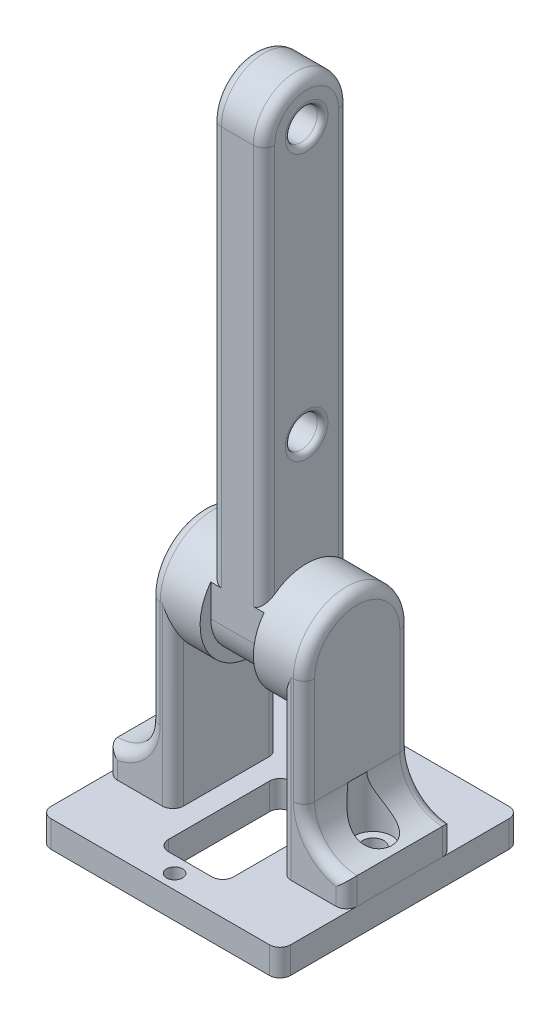
from build123d import *

# Parameters (mm, degrees)
CROQUIS1_W              = 45
CROQUIS1_H              = 45
CROQUIS1_R              = 2
CROQUIS1_R_2            = 1.5
CROQUIS1_W_2            = 12.2
CROQUIS1_H_2            = 23
SALIENTE_EXTRUIR1_DEPTH = 5
CORTAR_EXTRUIR1_START   = -2
CROQUIS2_R              = 2
CROQUIS2_R_2            = 1.5
CORTAR_EXTRUIR1_DEPTH   = 2
CROQUIS3_R              = 3
SALIENTE_EXTRUIR2_DEPTH = 5
SALIENTE_EXTRUIR4_DEPTH = 20
CORTAR_EXTRUIR2_START   = 10
CROQUIS4_R              = 2
CORTAR_EXTRUIR2_DEPTH   = 10
CROQUIS6_R              = 10
SALIENTE_EXTRUIR5_DEPTH = 9.5
REDONDEO3_R             = 2
REDONDEO4_R             = 1
REDONDEO5_R             = 2
CORTAR_EXTRUIR3_START   = 13
CROQUIS4_3_R            = 3.5
CROQUIS4_3_R_2          = 2
CORTAR_EXTRUIR3_DEPTH   = 9.79796
CORTAR_EXTRUIR4_START   = 3.202041
CROQUIS7_R              = 3.5
CROQUIS7_R_2            = 2
CORTAR_EXTRUIR4_DEPTH   = 9.797959


with BuildPart() as part:
    # Croquis1 → Saliente-Extruir1 (new body)
    with BuildSketch(Plane(origin=(0, 0, 0), x_dir=(1, 0, 0), z_dir=(0, 1, 0))):
        with Locations((0, 5.35)):
            Rectangle(CROQUIS1_W, CROQUIS1_H)
        with Locations(Location((-17.5, 5.35, 0), (0, 0, 270))):
            Circle(CROQUIS1_R, mode=Mode.SUBTRACT)
        with Locations(Location((17.5, 5.35, 0), (0, 0, 270))):
            Circle(CROQUIS1_R, mode=Mode.SUBTRACT)
        with Locations(Location((0, 14.45, 0), (0, 0, 270))):
            Circle(CROQUIS1_R_2, mode=Mode.SUBTRACT)
        with Locations(Location((0, -14.45, 0), (0, 0, 270))):
            Circle(CROQUIS1_R_2, mode=Mode.SUBTRACT)
        Rectangle(CROQUIS1_W_2, CROQUIS1_H_2, mode=Mode.SUBTRACT)
    extrude(amount=-SALIENTE_EXTRUIR1_DEPTH)

    # Croquis2 → Cortar-Extruir1 (cut)
    # profile 1 of 2: a face of its own
    with BuildSketch(Plane.XZ.offset(5).offset(CORTAR_EXTRUIR1_START)):
        with Locations(Location((0, -14.45, 0), (0, 0, 270))):
            Circle(CROQUIS2_R)
        with Locations(Location((0, -14.45, 0), (0, 0, 90))):
            Circle(CROQUIS2_R_2, mode=Mode.SUBTRACT)
    # profile 2 of 2: a face of its own
    with BuildSketch(Plane.XZ.offset(5).offset(CORTAR_EXTRUIR1_START)):
        with Locations(Location((0, 14.45, 0), (0, 0, 270))):
            Circle(CROQUIS2_R)
        with Locations(Location((0, 14.45, 0), (0, 0, 90))):
            Circle(CROQUIS2_R_2, mode=Mode.SUBTRACT)
    extrude(amount=CORTAR_EXTRUIR1_DEPTH, mode=Mode.SUBTRACT)

    # Redondeo3
    redondeo3_edges = [part.edges().sort_by_distance(p)[0] for p in [
        (-22.5, -2.5, 17.15),
        (-22.5, -2.5, -27.85),
        (22.5, -2.5, -27.85),
        (22.5, -2.5, 17.15),
        (6.1, -2.5, -11.5),
        (-6.1, -2.5, -11.5),
        (-6.1, -2.5, 11.5),
        (6.1, -2.5, 11.5),
    ]]
    fillet(redondeo3_edges, radius=REDONDEO3_R)


with BuildPart() as body_2:
    # Croquis3 → Saliente-Extruir2 (new, symmetric)
    with BuildSketch(Plane(origin=(0, 0, 0), x_dir=(0, 0, -1), z_dir=(1, 0, 0))):
        with BuildLine():
            Line((-2.65, 114), (-2.65, 33))
            ThreePointArc((-2.65, 33), (5.35, 25), (13.35, 33))
            Line((13.35, 33), (13.35, 114))
            ThreePointArc((13.35, 114), (5.35, 122), (-2.65, 114))
        make_face()
        with Locations((5.35, 64)):
            Circle(CROQUIS3_R, mode=Mode.SUBTRACT)
        with Locations((5.35, 114)):
            Circle(CROQUIS3_R, mode=Mode.SUBTRACT)
    extrude(amount=SALIENTE_EXTRUIR2_DEPTH, both=True)

    # Redondeo4
    redondeo4_edges = [body_2.edges().sort_by_distance(p)[0] for p in [
        (5, 114, -2.35),
        (5, 64, -2.35),
        (-5, 64, -2.35),
        (-5, 114, -2.35),
    ]]
    fillet(redondeo4_edges, radius=REDONDEO4_R)


with BuildPart() as body_3:
    # Croquis5 → Saliente-Extruir4 (new body)
    with BuildSketch(Plane.XY.offset(4.65)):
        with BuildLine():
            Line((10.1, 33), (10.1, 0))
            Line((10.1, 0), (22.5, 0))
            Line((22.5, 0), (22.5, 5))
            ThreePointArc((22.5, 5), (16.843145751, 7.343145751), (14.5, 13))
            Line((14.5, 13), (14.5, 33))
            Line((14.5, 33), (10.1, 33))
        make_face()
    extrude(amount=-SALIENTE_EXTRUIR4_DEPTH)

    # Croquis4 → Cortar-Extruir2 (cut)
    with BuildSketch(Plane(origin=(0, 0, 0), x_dir=(1, 0, 0), z_dir=(0, 1, 0)).offset(CORTAR_EXTRUIR2_START)):
        with Locations(Location((17.5, 5.35, 0), (0, 0, 270))):
            Circle(CROQUIS4_R)
    extrude(amount=-CORTAR_EXTRUIR2_DEPTH, mode=Mode.SUBTRACT)

    # Croquis6 → Saliente-Extruir5 (add)
    with BuildSketch(Plane(origin=(14.5, 0, 0), x_dir=(0, 0, -1), z_dir=(1, 0, 0))):
        with Locations((5.35, 33)):
            Circle(CROQUIS6_R)
    extrude(amount=-SALIENTE_EXTRUIR5_DEPTH)


with BuildPart() as body_4:
    # Simetría3: mirrored copy
    add(body_3.part.mirror(Plane(origin=(0, 0, 0), x_dir=(0, 0, 1), z_dir=(1, 0, 0))))


with BuildPart() as body_2_1:
    add(body_2.part)

    # Combinar2: union body 4, body 3
    add(body_4.part)
    add(body_3.part)

    # Redondeo5
    # the kernel refuses this fillet: 2 mm, written as the material it takes off along each edge
    with BuildSketch(Plane(origin=(-5, 114, 2.65), x_dir=(1, 0, 0), z_dir=(0, -1, 0))) as redondeo5_piece_1_section:
        with BuildLine():
            CenterArc((REDONDEO5_R, -REDONDEO5_R), REDONDEO5_R, 90, 90)
            Line((0, -REDONDEO5_R), (0, 0))
            Line((0, 0), (REDONDEO5_R, 0))
        make_face()
    redondeo5_piece_1 = extrude(amount=80, mode=Mode.PRIVATE)
    redondeo5_piece_1 = redondeo5_piece_1 - Plane(origin=(-4.548383498, 33, -5.35), x_dir=(0, 0, -1), z_dir=(-1, 0, 0)) * Cylinder(10, 168, mode=Mode.PRIVATE)
    add(redondeo5_piece_1, mode=Mode.SUBTRACT)
    with BuildSketch(Plane(origin=(-5, 114, -5.35), x_dir=(0, 0, -1), z_dir=(0, -1, 0))) as redondeo5_piece_2:
        with BuildLine():
            CenterArc((8 - REDONDEO5_R, REDONDEO5_R), REDONDEO5_R, 270, 90)
            Line((8 - REDONDEO5_R, 0), (8, 0))
            Line((8, 0), (8, REDONDEO5_R))
        make_face()
    revolve(axis=Axis((-5, 114, -5.35), (1, 0, 0)), revolution_arc=180, mode=Mode.SUBTRACT)
    with BuildSketch(Plane(origin=(-5, 34, -13.35), x_dir=(1, 0, 0), z_dir=(0, 1, 0))) as redondeo5_piece_3_section:
        with BuildLine():
            CenterArc((REDONDEO5_R, -REDONDEO5_R), REDONDEO5_R, 90, 90)
            Line((0, -REDONDEO5_R), (0, 0))
            Line((0, 0), (REDONDEO5_R, 0))
        make_face()
    redondeo5_piece_3 = extrude(amount=80, mode=Mode.PRIVATE)
    redondeo5_piece_3 = redondeo5_piece_3 - Plane(origin=(-4.548386162, 33, -5.35), x_dir=(0, 0, -1), z_dir=(-1, 0, 0)) * Cylinder(10, 169, mode=Mode.PRIVATE)
    add(redondeo5_piece_3, mode=Mode.SUBTRACT)
    with BuildSketch(Plane(origin=(5, 114, -5.35), x_dir=(0, 0, -1), z_dir=(0, -1, 0))) as redondeo5_piece_4:
        with BuildLine():
            CenterArc((8 - REDONDEO5_R, -REDONDEO5_R), REDONDEO5_R, 0, 90)
            Line((8, -REDONDEO5_R), (8, 0))
            Line((8, 0), (8 - REDONDEO5_R, 0))
        make_face()
    revolve(axis=Axis((5, 114, -5.35), (1, 0, 0)), revolution_arc=180, mode=Mode.SUBTRACT)
    with BuildSketch(Plane(origin=(5, 114, 2.65), x_dir=(0, 0, -1), z_dir=(0, -1, 0))) as redondeo5_piece_5_section:
        with BuildLine():
            CenterArc((REDONDEO5_R, -REDONDEO5_R), REDONDEO5_R, 90, 90)
            Line((0, -REDONDEO5_R), (0, 0))
            Line((0, 0), (REDONDEO5_R, 0))
        make_face()
    redondeo5_piece_5 = extrude(amount=80, mode=Mode.PRIVATE)
    redondeo5_piece_5 = redondeo5_piece_5 - Plane(origin=(4.662757954, 33, -5.35), x_dir=(0, 0, -1), z_dir=(1, 0, 0)) * Cylinder(10, 168, mode=Mode.PRIVATE)
    add(redondeo5_piece_5, mode=Mode.SUBTRACT)
    with BuildSketch(Plane(origin=(-22.5, 13, 4.65), x_dir=(-0.5853008610590881, -0.8108161949810142, 0), z_dir=(-0.8108161949810142, 0.5853008610590881, 0))) as redondeo5_piece_6:
        with BuildLine():
            CenterArc((8 + REDONDEO5_R, -REDONDEO5_R), REDONDEO5_R, 90, 90)
            Line((8, -REDONDEO5_R), (8, 0))
            Line((8, 0), (8 + REDONDEO5_R, 0))
        make_face()
    revolve(axis=Axis((-22.5, 13, 4.65), (0, 0, 1)), revolution_arc=125.824247309, mode=Mode.SUBTRACT)
    with BuildSketch(Plane(origin=(-10.1, 38, -15.35), x_dir=(0, 0, 1), z_dir=(0, -1, 0))) as redondeo5_piece_7_section:
        with BuildLine():
            CenterArc((REDONDEO5_R, REDONDEO5_R), REDONDEO5_R, 180, 90)
            Line((0, REDONDEO5_R), (0, 0))
            Line((0, 0), (REDONDEO5_R, 0))
        make_face()
    redondeo5_piece_7 = extrude(amount=43, mode=Mode.PRIVATE)
    redondeo5_piece_7 = redondeo5_piece_7 - Plane(origin=(-10.55636002, 33, -5.35), x_dir=(0, 0, -1), z_dir=(-1, 0, 0)) * Cylinder(10, 94, mode=Mode.PRIVATE)
    add(redondeo5_piece_7, mode=Mode.SUBTRACT)
    with BuildSketch(Plane(origin=(-14.5, 13, 4.65), x_dir=(0, 0, -1), z_dir=(0, 1, 0)), Plane(origin=(14.5, 13, -15.35), x_dir=(0, 0, 1), z_dir=(0, 1, 0))) as redondeo5_piece_8:
        with BuildLine():
            CenterArc((REDONDEO5_R, -REDONDEO5_R), REDONDEO5_R, 90, 90)
            Line((0, -REDONDEO5_R), (0, 0))
            Line((0, 0), (REDONDEO5_R, 0))
        make_face()
    extrude(amount=20, mode=Mode.SUBTRACT)
    with BuildSketch(Plane(origin=(-22.5, -5, 4.65), x_dir=(1, 0, 0), z_dir=(0, 1, 0)), Plane(origin=(22.5, -5, -15.35), x_dir=(-1, 0, 0), z_dir=(0, 1, 0))) as redondeo5_piece_9:
        with BuildLine():
            CenterArc((REDONDEO5_R, REDONDEO5_R), REDONDEO5_R, 180, 90)
            Line((0, REDONDEO5_R), (0, 0))
            Line((0, 0), (REDONDEO5_R, 0))
        make_face()
    extrude(amount=15, mode=Mode.SUBTRACT)
    with BuildSketch(Plane(origin=(-22.5, -5, -15.35), x_dir=(1, 0, 0), z_dir=(0, 1, 0)), Plane(origin=(22.5, -5, 4.65), x_dir=(-1, 0, 0), z_dir=(0, 1, 0))) as redondeo5_piece_10:
        with BuildLine():
            CenterArc((REDONDEO5_R, -REDONDEO5_R), REDONDEO5_R, 90, 90)
            Line((0, -REDONDEO5_R), (0, 0))
            Line((0, 0), (REDONDEO5_R, 0))
        make_face()
    extrude(amount=15, mode=Mode.SUBTRACT)
    with BuildSketch(Plane(origin=(-22.5, 13, -15.35), x_dir=(-0.5853008610590881, -0.8108161949810142, 0), z_dir=(-0.8108161949810142, 0.5853008610590881, 0))) as redondeo5_piece_11:
        with BuildLine():
            CenterArc((8 + REDONDEO5_R, REDONDEO5_R), REDONDEO5_R, 180, 90)
            Line((8, REDONDEO5_R), (8, 0))
            Line((8, 0), (8 + REDONDEO5_R, 0))
        make_face()
    revolve(axis=Axis((-22.5, 13, -15.35), (0, 0, 1)), revolution_arc=125.824247309, mode=Mode.SUBTRACT)
    with BuildSketch(Plane(origin=(-14.5, 13, -15.35), x_dir=(0, 0, 1), z_dir=(0, 1, 0)), Plane(origin=(14.5, 13, 4.65), x_dir=(0, 0, -1), z_dir=(0, 1, 0))) as redondeo5_piece_12:
        with BuildLine():
            CenterArc((REDONDEO5_R, REDONDEO5_R), REDONDEO5_R, 180, 90)
            Line((0, REDONDEO5_R), (0, 0))
            Line((0, 0), (REDONDEO5_R, 0))
        make_face()
    extrude(amount=20, mode=Mode.SUBTRACT)
    with BuildSketch(Plane(origin=(-10.1, 38, 4.65), x_dir=(-1, 0, 0), z_dir=(0, -1, 0))) as redondeo5_piece_13_section:
        with BuildLine():
            CenterArc((REDONDEO5_R, REDONDEO5_R), REDONDEO5_R, 180, 90)
            Line((0, REDONDEO5_R), (0, 0))
            Line((0, 0), (REDONDEO5_R, 0))
        make_face()
    redondeo5_piece_13 = extrude(amount=43, mode=Mode.PRIVATE)
    redondeo5_piece_13 = redondeo5_piece_13 - Plane(origin=(-10.556359169, 33, -5.35), x_dir=(0, 0, -1), z_dir=(-1, 0, 0)) * Cylinder(10, 94, mode=Mode.PRIVATE)
    add(redondeo5_piece_13, mode=Mode.SUBTRACT)
    with BuildSketch(Plane(origin=(-14.5, 33, -5.35), x_dir=(0, 0, -1), z_dir=(0, -1, 0))) as redondeo5_piece_14:
        with BuildLine():
            CenterArc((10 - REDONDEO5_R, REDONDEO5_R), REDONDEO5_R, 270, 90)
            Line((10 - REDONDEO5_R, 0), (10, 0))
            Line((10, 0), (10, REDONDEO5_R))
        make_face()
    revolve(axis=Axis((-14.5, 33, -5.35), (1, 0, 0)), revolution_arc=180, mode=Mode.SUBTRACT)
    with BuildSketch(Plane(origin=(5, 34, -13.35), x_dir=(0, 0, 1), z_dir=(0, 1, 0))) as redondeo5_piece_15_section:
        with BuildLine():
            CenterArc((REDONDEO5_R, -REDONDEO5_R), REDONDEO5_R, 90, 90)
            Line((0, -REDONDEO5_R), (0, 0))
            Line((0, 0), (REDONDEO5_R, 0))
        make_face()
    redondeo5_piece_15 = extrude(amount=80, mode=Mode.PRIVATE)
    redondeo5_piece_15 = redondeo5_piece_15 - Plane(origin=(4.548386169, 33, -5.35), x_dir=(0, 0, -1), z_dir=(1, 0, 0)) * Cylinder(10, 169, mode=Mode.PRIVATE)
    add(redondeo5_piece_15, mode=Mode.SUBTRACT)
    with BuildSketch(Plane(origin=(22.5, 13, -15.35), x_dir=(0.5853008610590881, -0.8108161949810142, 0), z_dir=(0.8108161949810142, 0.5853008610590881, 0))) as redondeo5_piece_16:
        with BuildLine():
            CenterArc((8 + REDONDEO5_R, -REDONDEO5_R), REDONDEO5_R, 90, 90)
            Line((8, -REDONDEO5_R), (8, 0))
            Line((8, 0), (8 + REDONDEO5_R, 0))
        make_face()
    revolve(axis=Axis((22.5, 13, -15.35), (0, 0, -1)), revolution_arc=125.824247309, mode=Mode.SUBTRACT)
    with BuildSketch(Plane(origin=(10.1, 38, 4.65), x_dir=(1, 0, 0), z_dir=(0, -1, 0))) as redondeo5_piece_17_section:
        with BuildLine():
            CenterArc((REDONDEO5_R, -REDONDEO5_R), REDONDEO5_R, 90, 90)
            Line((0, -REDONDEO5_R), (0, 0))
            Line((0, 0), (REDONDEO5_R, 0))
        make_face()
    redondeo5_piece_17 = extrude(amount=43, mode=Mode.PRIVATE)
    redondeo5_piece_17 = redondeo5_piece_17 - Plane(origin=(10.556359169, 33, -5.35), x_dir=(0, 0, -1), z_dir=(1, 0, 0)) * Cylinder(10, 94, mode=Mode.PRIVATE)
    add(redondeo5_piece_17, mode=Mode.SUBTRACT)
    with BuildSketch(Plane(origin=(14.5, 33, -5.35), x_dir=(0, 0, -1), z_dir=(0, -1, 0))) as redondeo5_piece_18:
        with BuildLine():
            CenterArc((10 - REDONDEO5_R, -REDONDEO5_R), REDONDEO5_R, 0, 90)
            Line((10 - REDONDEO5_R, 0), (10, 0))
            Line((10, 0), (10, -REDONDEO5_R))
        make_face()
    revolve(axis=Axis((14.5, 33, -5.35), (1, 0, 0)), revolution_arc=180, mode=Mode.SUBTRACT)
    with BuildSketch(Plane(origin=(10.1, 38, -15.35), x_dir=(0, 0, 1), z_dir=(0, -1, 0))) as redondeo5_piece_19_section:
        with BuildLine():
            CenterArc((REDONDEO5_R, -REDONDEO5_R), REDONDEO5_R, 90, 90)
            Line((0, -REDONDEO5_R), (0, 0))
            Line((0, 0), (REDONDEO5_R, 0))
        make_face()
    redondeo5_piece_19 = extrude(amount=43, mode=Mode.PRIVATE)
    redondeo5_piece_19 = redondeo5_piece_19 - Plane(origin=(10.55636002, 33, -5.35), x_dir=(0, 0, -1), z_dir=(1, 0, 0)) * Cylinder(10, 94, mode=Mode.PRIVATE)
    add(redondeo5_piece_19, mode=Mode.SUBTRACT)
    with BuildSketch(Plane(origin=(22.5, 13, 4.65), x_dir=(0.5853008610590881, -0.8108161949810142, 0), z_dir=(0.8108161949810142, 0.5853008610590881, 0))) as redondeo5_piece_20:
        with BuildLine():
            CenterArc((8 + REDONDEO5_R, REDONDEO5_R), REDONDEO5_R, 180, 90)
            Line((8, REDONDEO5_R), (8, 0))
            Line((8, 0), (8 + REDONDEO5_R, 0))
        make_face()
    revolve(axis=Axis((22.5, 13, 4.65), (0, 0, -1)), revolution_arc=125.824247309, mode=Mode.SUBTRACT)

    # Croquis4<3> → Cortar-Extruir3 (cut)
    with BuildSketch(Plane(origin=(0, 0, 0), x_dir=(1, 0, 0), z_dir=(0, 1, 0)).offset(CORTAR_EXTRUIR3_START)):
        with Locations(Location((17.5, 5.35, 0), (0, 0, 270))):
            Circle(CROQUIS4_3_R)
        with Locations(Location((17.5, 5.35, 0), (0, 0, 270))):
            Circle(CROQUIS4_3_R_2, mode=Mode.SUBTRACT)
    extrude(amount=-CORTAR_EXTRUIR3_DEPTH, mode=Mode.SUBTRACT)

    # Croquis7 → Cortar-Extruir4 (cut)
    with BuildSketch(Plane(origin=(0, 0, 0), x_dir=(1, 0, 0), z_dir=(0, 1, 0)).offset(CORTAR_EXTRUIR4_START)):
        with Locations(Location((-17.5, 5.35, 0), (0, 0, 270))):
            Circle(CROQUIS7_R)
        with Locations(Location((-17.5, 5.35, 0), (0, 0, 270))):
            Circle(CROQUIS7_R_2, mode=Mode.SUBTRACT)
    extrude(amount=CORTAR_EXTRUIR4_DEPTH, mode=Mode.SUBTRACT)


solid = Compound([part.part, body_2_1.part])
